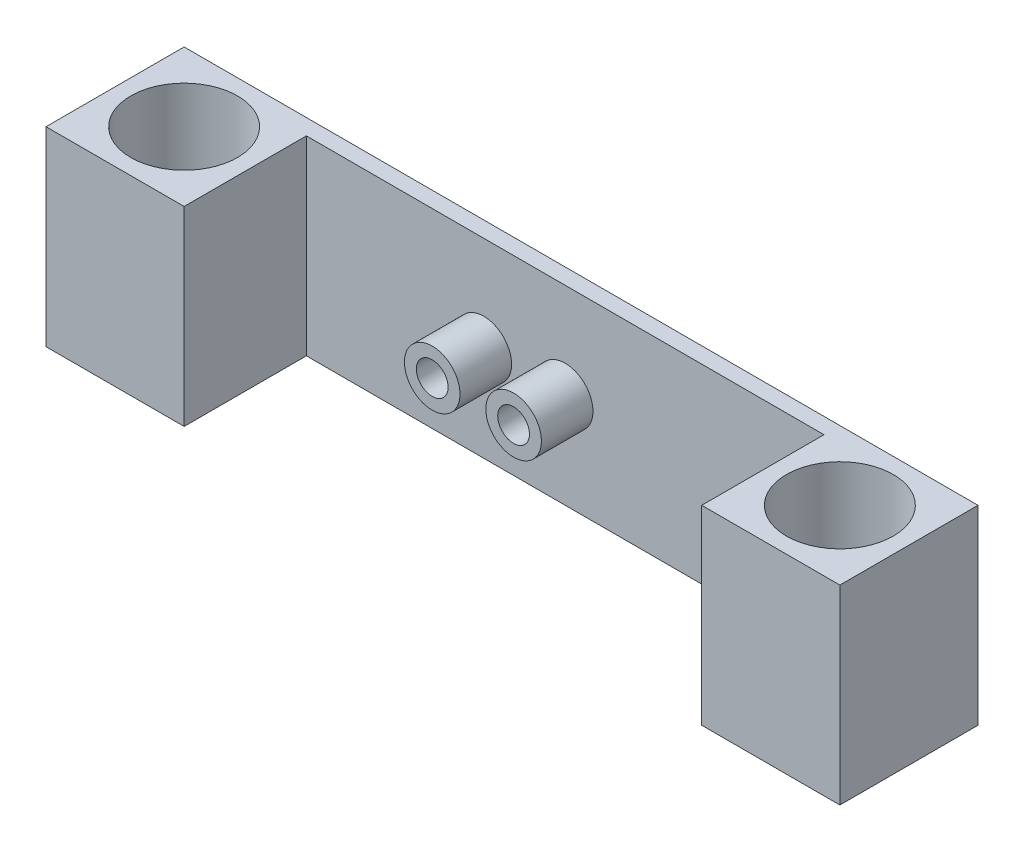
from build123d import *

# Parameters (mm, degrees)
SKETCH1_R           = 13.45
BOSS_EXTRUDE2_DEPTH = 48
SKETCH7_R           = 7
SKETCH7_R_2         = 4
BOSS_EXTRUDE3_DEPTH = 13


with BuildPart() as part:
    # Sketch1 → Boss-Extrude2 (new body)
    with BuildSketch(Plane(origin=(0, 0, 0), x_dir=(1, 0, 0), z_dir=(0, 1, 0))):
        Polygon((-17.4, 17.4), (17.4, 17.4), (17.4, -17.4), (-17.4, -17.4), (-17.4, 13.4), (-82.6, 13.4), (-82.6, 17.4), align=None)
        Circle(SKETCH1_R, mode=Mode.SUBTRACT)
    boss_extrude2 = extrude(amount=BOSS_EXTRUDE2_DEPTH)

    # Mirror2: Boss-Extrude2 across plane
    add(boss_extrude2.mirror(Plane(origin=(-82.6, 48, -17.4), x_dir=(0, 0, 1), z_dir=(1, 0, 0))))

    # Sketch7 → Boss-Extrude3 (add)
    # profile 1 of 2: a face of its own
    with BuildSketch(Plane.XY.offset(-13.4)):
        with Locations((-82.6, 24)):
            Circle(SKETCH7_R)
        with Locations((-82.6, 24)):
            Circle(SKETCH7_R_2, mode=Mode.SUBTRACT)
    # profile 2 of 2: a face of its own
    with BuildSketch(Plane.XY.offset(-13.4)):
        with Locations((-103.1, 24)):
            Circle(SKETCH7_R)
        with Locations((-103.1, 24)):
            Circle(SKETCH7_R_2, mode=Mode.SUBTRACT)
    extrude(amount=BOSS_EXTRUDE3_DEPTH)


solid = part.part
